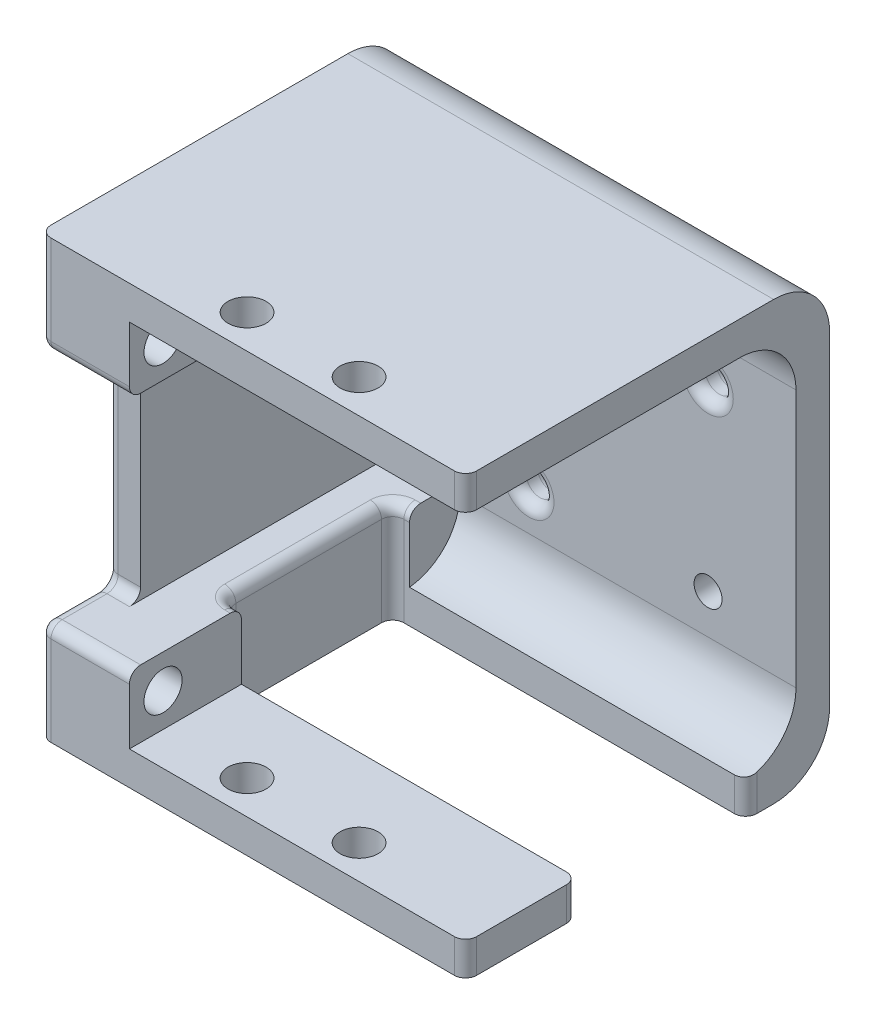
from build123d import *

# Parameters (mm, degrees)
EXTRUDE_1_DEPTH     = 30
HOLE_WIZARD_M4_1_D  = 2.5
SKETCH_13_W         = 3
SKETCH_13_H         = 21
SKETCH_13_W_2       = 29.5
SKETCH_13_H_2       = 6
EXTRUDE_2_DEPTH     = 5
HOLE_WIZARD_M3_1_D  = 3.4
HOLE_WIZARD_M3_2_D  = 3.4
SKETCH_18_W         = 33
SKETCH_18_H         = 15
CUT_EXTRUDE_1_DEPTH = 11
SKETCH_20_W         = 32.5
SKETCH_20_H         = 39
EXTRUDE_3_DEPTH     = 3
FILLET_3_R          = 5
FILLET_4_R          = 5
FILLET_5_R          = 1
HOLE_WIZARD_M3_3_D  = 3.4
SKETCH_24_W         = 6
SKETCH_24_H         = 21
CUT_EXTRUDE_2_DEPTH = 10
FILLET_6_R          = 1
FILLET1_R           = 1


with BuildPart() as part:
    # 草图1 → 凸台-拉伸1 (new body)
    with BuildSketch(Plane(origin=(0, 0, 0), x_dir=(0, 0, -1), z_dir=(1, 0, 0))):
        Polygon((0, 0), (29.5, 0), (29.5, 33), (0, 33), (0, 36), (32.5, 36), (32.5, -3), (0, -3), align=None)
    extrude(amount=EXTRUDE_1_DEPTH)

    # M4 间隙孔1 (through all)
    with Locations(Plane.XY.offset(-29.5)):
        with Locations((6.15, 24.5), (22.15, 24.5), (6.15, 8.5), (22.15, 8.5)):
            Hole(HOLE_WIZARD_M4_1_D / 2)

    # 草图13 → 凸台-拉伸2 (add)
    with BuildSketch(Plane(origin=(0, 0, 0), x_dir=(0, 0, -1), z_dir=(1, 0, 0))):
        with Locations((31, 16.5)):
            Rectangle(SKETCH_13_W, SKETCH_13_H)
        with Locations((14.75, 3)):
            Rectangle(SKETCH_13_W_2, SKETCH_13_H_2)
        Polygon((0, 0), (0, -3), (32.5, -3), (32.5, 6), (29.5, 6), (29.5, 0), align=None)
        with Locations((14.75, 30)):
            Rectangle(SKETCH_13_W_2, SKETCH_13_H_2)
        Polygon((29.5, 27), (32.5, 27), (32.5, 36), (0, 36), (0, 33), (29.5, 33), align=None)
    extrude(amount=-EXTRUDE_2_DEPTH)

    # M3 间隙孔1 (through all)
    with Locations(Plane(origin=(0, -3, 0), x_dir=(-1, 0, 0), z_dir=(0, -1, 0))):
        with Locations((-7.5, 3), (-17.5, 3)):
            Hole(HOLE_WIZARD_M3_1_D / 2)

    # M3 间隙孔2 (through all)
    with Locations(Plane.ZY.offset(5)):
        with Locations((-3, 30), (-3, 3)):
            Hole(HOLE_WIZARD_M3_2_D / 2)

    # 草图18 → 切除-拉伸1 (cut)
    with BuildSketch(Plane.XZ.offset(3)):
        with Locations((15, -17.5)):
            Rectangle(SKETCH_18_W, SKETCH_18_H)
    extrude(amount=-CUT_EXTRUDE_1_DEPTH, mode=Mode.SUBTRACT)

    # 草图20 → 凸台-拉伸3 (add)
    with BuildSketch(Plane.ZY.offset(5)):
        with Locations((-16.25, 16.5)):
            Rectangle(SKETCH_20_W, SKETCH_20_H)
    extrude(amount=EXTRUDE_3_DEPTH)

    # 圆角3
    fillet_3_edges = [part.edges().sort_by_distance(p)[0] for p in [
        (11, -3, -32.5),
        (11, 36, -32.5),
    ]]
    fillet(fillet_3_edges, radius=FILLET_3_R)

    # 圆角4
    # the kernel refuses this fillet: 5 mm, written as the material it adds along each edge
    with BuildSketch(Plane(origin=(0, 33, -29.5), x_dir=(0, -1, 0), z_dir=(1, 0, 0))) as fillet_4_piece_1:
        with BuildLine():
            CenterArc((FILLET_4_R, -FILLET_4_R), FILLET_4_R, 90, 90)
            Line((0, -FILLET_4_R), (0, 0))
            Line((0, 0), (FILLET_4_R, 0))
        make_face()
    extrude(amount=30)
    with BuildSketch(Plane(origin=(0, 0, -29.5), x_dir=(0, 0, 1), z_dir=(1, 0, 0))) as fillet_4_piece_2:
        with BuildLine():
            CenterArc((5, -4.974937186), FILLET_4_R, 95.739170477, 84.260829523)
            Line((0, -4.974937186), (0, 0))
            Line((0, 0), (4.5, 0))
        make_face()
    extrude(amount=30)

    # 圆角5
    fillet_5_edges = [part.edges().sort_by_distance(p)[0] for p in [
        (-1.5, 6, -17.5),
        (-0.75, 6, -25),
        (-0.75, 6, -10),
        (-1.5, 1.5, -25),
        (-1.5, 1.5, -10),
        (30, 34.5, 0),
        (30, -1.5, -10),
        (30, -1.5, -25),
        (-8, 16.5, 0),
        (30, -1.5, 0),
    ]]
    fillet(fillet_5_edges, radius=FILLET_5_R)

    # M3 间隙孔3 (through all)
    with Locations(Plane(origin=(-5, 0, 0), x_dir=(0, 0, -1), z_dir=(1, 0, 0))):
        with Locations((3, 30), (3, 3)):
            Hole(HOLE_WIZARD_M3_3_D / 2)

    # 草图24 → 切除-拉伸2 (cut)
    with BuildSketch(Plane(origin=(-5, 0, 0), x_dir=(0, 0, -1), z_dir=(1, 0, 0))):
        with Locations((3, 16.5)):
            Rectangle(SKETCH_24_W, SKETCH_24_H)
    extrude(amount=-CUT_EXTRUDE_2_DEPTH, mode=Mode.SUBTRACT)

    # 圆角6
    fillet_6_edges = [part.edges().sort_by_distance(p)[0] for p in [
        (-7.707106781, 6, -0.292893219),
        (-7.707106781, 27, -0.292893219),
        (-8, 16.5, -6),
        (-8, 27, -3.5),
        (-8, 6, -3.5),
        (-6.5, 27, -6),
        (-6.5, 6, -6),
        (-3.5, 6, 0),
        (-3.5, 27, 0),
    ]]
    fillet(fillet_6_edges, radius=FILLET_6_R)

    # Fillet1
    fillet1_edges = [part.edges().sort_by_distance(p)[0] for p in [
        (7.4, 8.5, -29.5),
        (7.4, 8.5, -32.5),
        (23.4, 24.5, -29.5),
        (23.4, 24.5, -32.5),
    ]]
    fillet(fillet1_edges, radius=FILLET1_R)


solid = part.part
